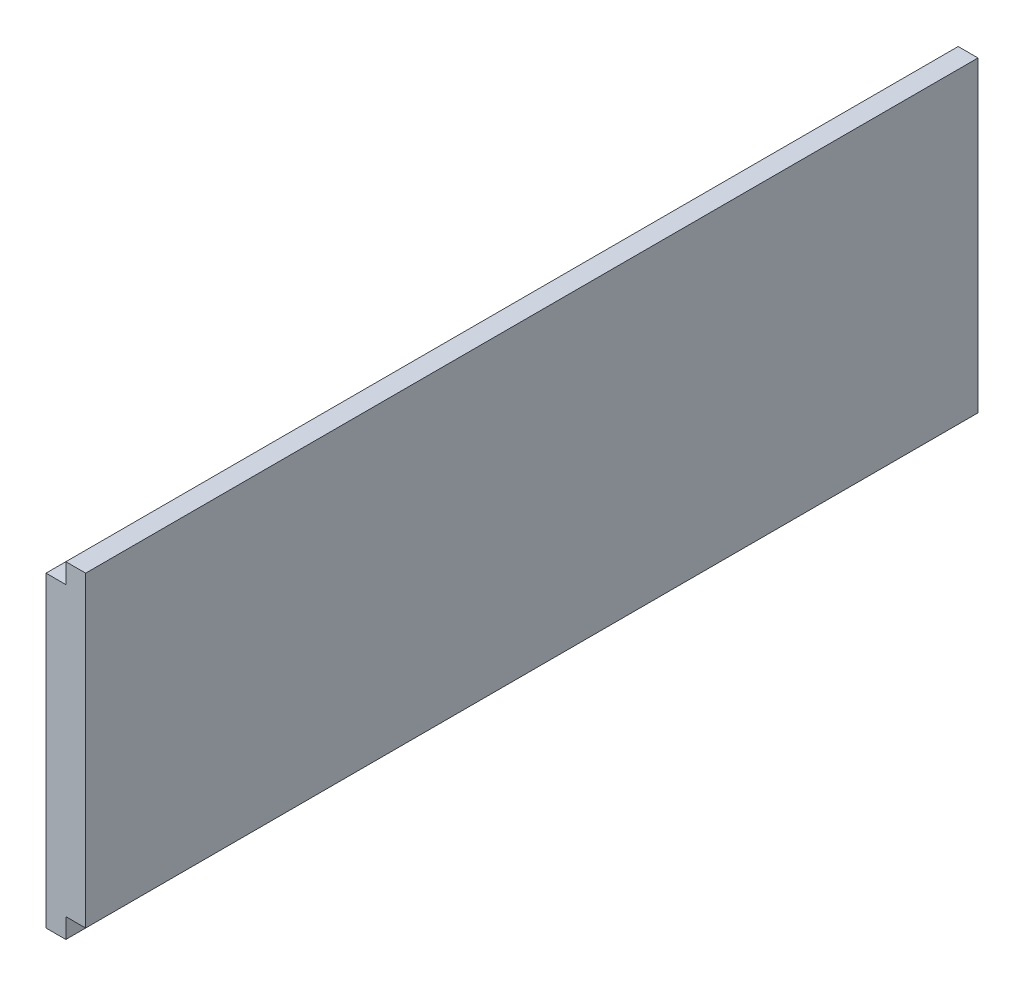
from build123d import *

# Parameters (mm, degrees)
EXTRUDE_1_DEPTH = 450


with BuildPart() as part:
    # Эскиз1 → Бобышка-Вытянуть1 (new body)
    with BuildSketch(Plane.XY):
        Polygon((0, 0), (0, 155), (10, 155), (10, 165), (20, 165), (20, 10), (10, 10), (10, 0), align=None)
    extrude(amount=EXTRUDE_1_DEPTH)


solid = part.part
